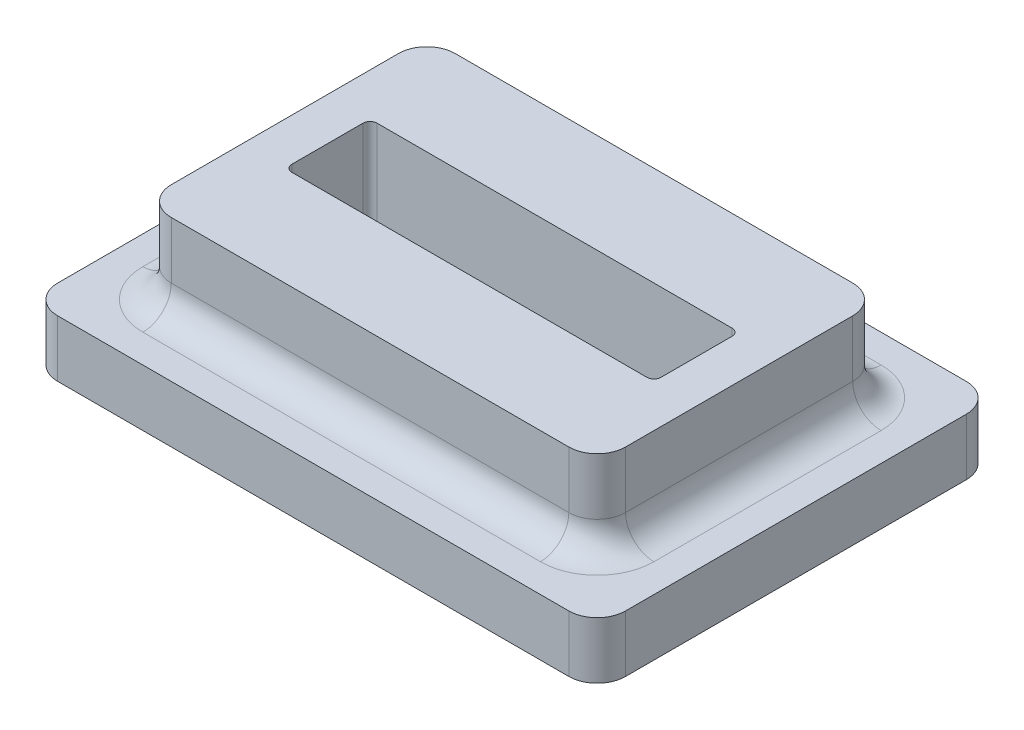
from build123d import *

# Parameters (mm, degrees)
SKETCH1_W           = 16
SKETCH1_H           = 10
SKETCH1_W_2         = 13
SKETCH1_H_2         = 3
BOSS_EXTRUDE1_DEPTH = 3
SKETCH2_W           = 20
SKETCH2_H           = 14
SKETCH2_W_2         = 13
SKETCH2_H_2         = 3
BOSS_EXTRUDE2_DEPTH = 2
FILLET1_R           = 1
FILLET2_R           = 1
FILLET3_R           = 0.25


with BuildPart() as part:
    # Sketch1 → Boss-Extrude1 (new body)
    with BuildSketch(Plane(origin=(0, 0, 0), x_dir=(1, 0, 0), z_dir=(0, 1, 0))):
        with Locations((8, -5)):
            Rectangle(SKETCH1_W, SKETCH1_H)
        with Locations((8, -5)):
            Rectangle(SKETCH1_W_2, SKETCH1_H_2, mode=Mode.SUBTRACT)
    extrude(amount=BOSS_EXTRUDE1_DEPTH)

    # Sketch2 → Boss-Extrude2 (add)
    with BuildSketch(Plane.XZ):
        with Locations((8, 5)):
            Rectangle(SKETCH2_W, SKETCH2_H)
        with Locations((8, 5)):
            Rectangle(SKETCH2_W_2, SKETCH2_H_2, mode=Mode.SUBTRACT)
    extrude(amount=BOSS_EXTRUDE2_DEPTH)

    # Fillet1
    fillet1_edges = [part.edges().sort_by_distance(p)[0] for p in [
        (8, 0, 10),
        (16, 1.5, 0),
        (16, 1.5, 10),
        (16, 0, 5),
        (0, 1.5, 10),
        (0, 1.5, 0),
        (0, 0, 5),
        (8, 0, 0),
    ]]
    fillet(fillet1_edges, radius=FILLET1_R)

    # Fillet2
    fillet2_edges = [part.edges().sort_by_distance(p)[0] for p in [
        (-2, -1, -2),
        (18, -1, -2),
        (18, -1, 12),
        (-2, -1, 12),
    ]]
    fillet(fillet2_edges, radius=FILLET2_R)

    # Fillet3
    fillet3_edges = [part.edges().sort_by_distance(p)[0] for p in [
        (14.5, 0.5, 6.5),
        (14.5, 0.5, 3.5),
        (1.5, 0.5, 6.5),
        (1.5, 0.5, 3.5),
    ]]
    fillet(fillet3_edges, radius=FILLET3_R)


solid = part.part
